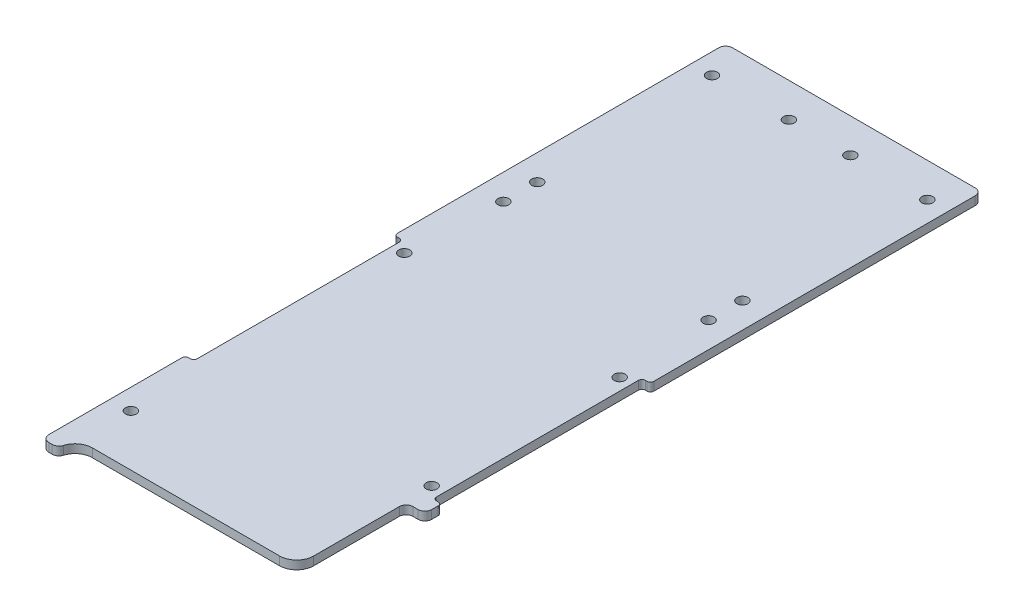
from build123d import *

# Parameters (mm, degrees)
SKETCH1_R               = 2.032
BOSS_EXTRUDE1_DEPTH     = 3.175
FILLET1_R               = 2.54
FILLET2_R               = 2.54
FILLET3_R               = 6.35
CUT_EXTRUDE1_DEPTH      = 136.673215063
FILLET4_R               = 6.35
FILLET5_R               = 2.54
SKETCH3_R               = 2.032
CUT_EXTRUDE2_DEPTH      = 136.673215063
CUT_EXTRUDE3_DEPTH      = 136.673215063
CUT_EXTRUDE3_DEPTH_BACK = 136.673215063
SKETCH4_W               = 3.17499648
SKETCH4_H               = 77.591915544
SKETCH4_W_2             = 3.17500352
FILLET6_R               = 1.27


with BuildPart() as part:
    # Sketch1 → Boss-Extrude1 (new body)
    with BuildSketch(Plane(origin=(0, 0, 0), x_dir=(1, 0, 0), z_dir=(0, 1, 0))):
        Polygon((47.625, 127), (-47.625, 127), (-47.625, -127), (-41.275, -127), (-41.275, -120.65), (41.275, -120.65), (41.275, -127), (47.625, -127), align=None)
        with Locations((-39.999684148, -101.6)):
            Circle(SKETCH1_R, mode=Mode.SUBTRACT)
        with Locations((39.999684148, -69.85)):
            Circle(SKETCH1_R, mode=Mode.SUBTRACT)
        with Locations((-39.999684148, 0)):
            Circle(SKETCH1_R, mode=Mode.SUBTRACT)
        with Locations((-39.999684148, 114.3)):
            Circle(SKETCH1_R, mode=Mode.SUBTRACT)
        with Locations((-11.424684148, 114.3)):
            Circle(SKETCH1_R, mode=Mode.SUBTRACT)
        with Locations((39.999684148, 0)):
            Circle(SKETCH1_R, mode=Mode.SUBTRACT)
        with Locations((11.424684148, 114.3)):
            Circle(SKETCH1_R, mode=Mode.SUBTRACT)
        with Locations((39.999684148, 114.3)):
            Circle(SKETCH1_R, mode=Mode.SUBTRACT)
    extrude(amount=BOSS_EXTRUDE1_DEPTH)

    # Fillet1
    fillet1_edges = [part.edges().sort_by_distance(p)[0] for p in [
        (-47.625, 1.5875, -127),
        (47.625, 1.5875, -127),
        (47.625, 1.5875, 127),
        (-47.625, 1.5875, 127),
    ]]
    fillet(fillet1_edges, radius=FILLET1_R)

    # Fillet2
    fillet2_edges = [part.edges().sort_by_distance(p)[0] for p in [
        (41.275, 1.5875, 127),
        (-41.275, 1.5875, 127),
    ]]
    fillet(fillet2_edges, radius=FILLET2_R)

    # Fillet3
    fillet3_edges = [part.edges().sort_by_distance(p)[0] for p in [
        (41.275, 1.5875, 120.65),
        (-41.275, 1.5875, 120.65),
    ]]
    fillet(fillet3_edges, radius=FILLET3_R)

    # Sketch2 → Cut-Extrude1 (cut, through all)
    with BuildSketch(Plane.XZ):
        with BuildLine():
            Line((47.625, 131.883089137), (41.911299397, 131.883089137))
            Line((41.911299397, 131.883089137), (41.911299397, 126.141524313))
            ThreePointArc((41.911299397, 126.141524313), (41.594062253, 125.692491593), (41.380880287, 125.185714286))
            ThreePointArc((41.380880287, 125.185714286), (41.06770588, 124.353289885), (40.641299397, 123.572786135))
            Line((40.641299397, 123.572786135), (40.641299397, 79.981419179))
            Line((40.641299397, 79.981419179), (47.625, 79.981419179))
            Line((47.625, 79.981419179), (47.625, 131.883089137))
        make_face()
    extrude(amount=-CUT_EXTRUDE1_DEPTH, mode=Mode.SUBTRACT)

    # Fillet4
    fillet4_edges = [part.edges().sort_by_distance(p)[0] for p in [
        (40.641299397, 1.5875, 123.572786135),
    ]]
    fillet(fillet4_edges, radius=FILLET4_R)

    # Fillet5
    fillet5_edges = [part.edges().sort_by_distance(p)[0] for p in [
        (47.625, 1.5875, 79.981419179),
        (40.641299397, 1.5875, 79.981419179),
    ]]
    fillet(fillet5_edges, radius=FILLET5_R)

    # Sketch3 → Cut-Extrude2 (cut, through all)
    with BuildSketch(Plane.XZ):
        with Locations((-38.112624028, -34.913768806)):
            Circle(SKETCH3_R)
        with Locations((-38.112624028, -47.490173279)):
            Circle(SKETCH3_R)
        with Locations((38.112624028, -47.490173279)):
            Circle(SKETCH3_R)
        with Locations((38.112624028, -34.913768806)):
            Circle(SKETCH3_R)
    extrude(amount=-CUT_EXTRUDE2_DEPTH, mode=Mode.SUBTRACT)

    # Sketch4 → Cut-Extrude3 (cut, two sides: drawn at the far end of the back side and taken through both)
    with BuildSketch(Plane(origin=(0, 3.175, 0), x_dir=(1, 0, 0), z_dir=(0, 1, 0)).offset(-CUT_EXTRUDE3_DEPTH_BACK)):
        with Locations((-46.03750176, -34.98594711)):
            Rectangle(SKETCH4_W, SKETCH4_H)
        with Locations((46.03749824, -34.98594711)):
            Rectangle(SKETCH4_W_2, SKETCH4_H)
    extrude(amount=CUT_EXTRUDE3_DEPTH + CUT_EXTRUDE3_DEPTH_BACK, mode=Mode.SUBTRACT)

    # Fillet6
    fillet6_edges = [part.edges().sort_by_distance(p)[0] for p in [
        (-44.45000352, 1.5875, -3.810010662),
        (-44.45000352, 1.5875, 73.781904882),
        (44.44999648, 1.5875, -3.810010662),
        (44.44999648, 1.5875, 73.781904882),
        (47.625, 1.5875, 73.781904882),
        (47.625, 1.5875, -3.810010662),
        (-47.625, 1.5875, 73.781904882),
        (-47.625, 1.5875, -3.810010662),
    ]]
    fillet(fillet6_edges, radius=FILLET6_R)


solid = part.part
